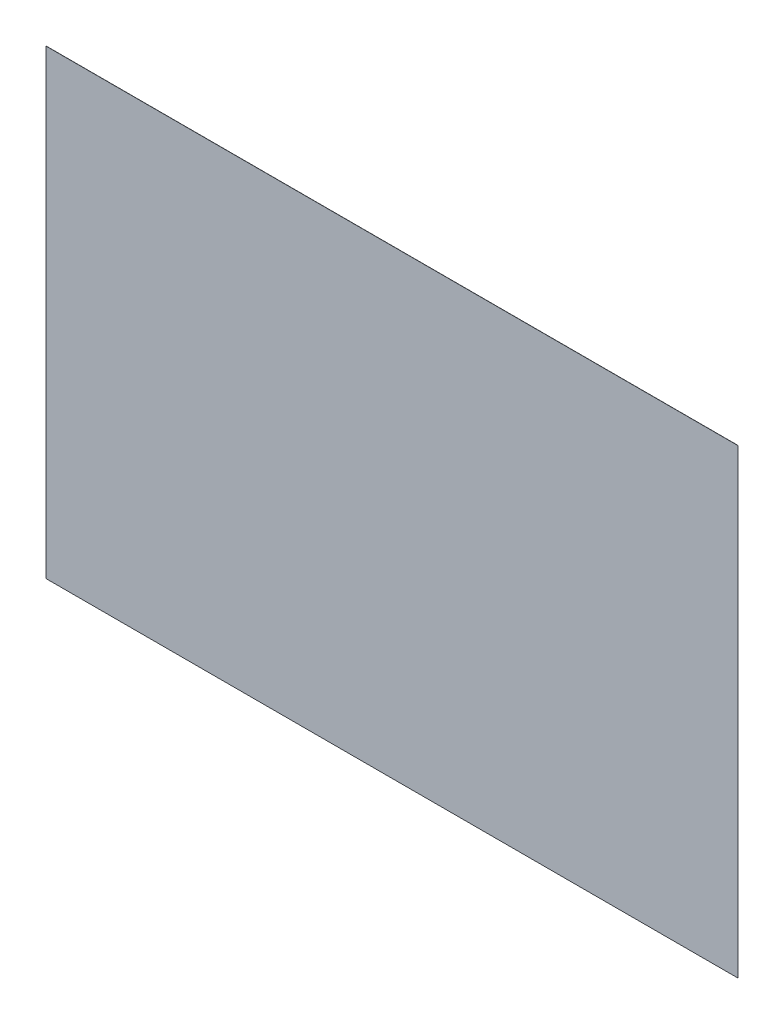
from build123d import *

# Parameters (mm, degrees)
SKETCH_1_W      = 3885
SKETCH_1_H      = 2590
EXTRUDE_1_DEPTH = 1


with BuildPart() as part:
    # Эскиз1 → Бобышка-Вытянуть1 (new body)
    with BuildSketch(Plane.XY):
        Rectangle(SKETCH_1_W, SKETCH_1_H)
    extrude(amount=EXTRUDE_1_DEPTH)


solid = part.part
